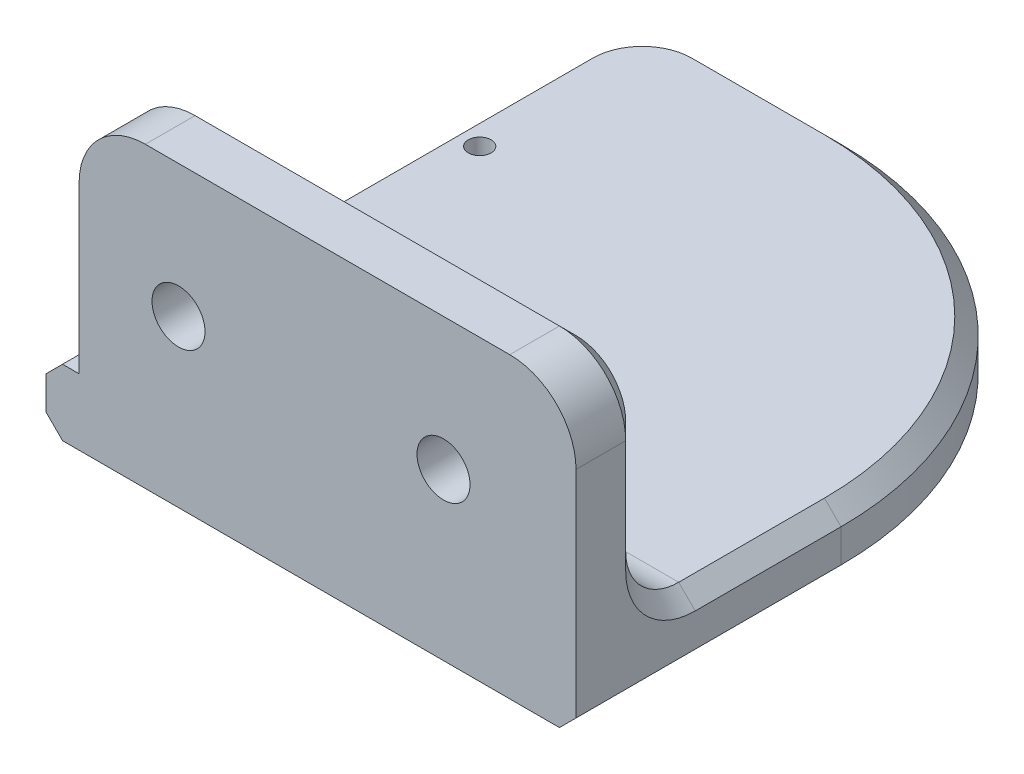
from build123d import *

# Parameters (mm, degrees)
BOSS_EXTRUDE1_DEPTH = 50.8
SKETCH2_R           = 2.54
CUT_EXTRUDE1_DEPTH  = 82.628996839
SKETCH3_R           = 1.0922
CUT_EXTRUDE2_DEPTH  = 82.628996839
FILLET2_R           = 31.75
SKETCH4_W           = 3.175
SKETCH4_H           = 22.225
CUT_EXTRUDE3_DEPTH  = 78.316302453
FILLET3_R           = 6.35
FILLET4_R           = 5.08
CHAMFER1_SIZE       = 1.5875


with BuildPart() as part:
    # Sketch1 → Boss-Extrude1 (new body)
    with BuildSketch(Plane(origin=(0, 0, 0), x_dir=(0, 0, -1), z_dir=(1, 0, 0))):
        Polygon((0, 0), (0, 28.575), (6.35, 28.575), (6.35, 6.35), (57.15, 6.35), (57.15, 0), align=None)
    extrude(amount=BOSS_EXTRUDE1_DEPTH)

    # Sketch2 → Cut-Extrude1 (cut, through all)
    with BuildSketch(Plane.XY):
        with Locations((12.7, 15.875)):
            Circle(SKETCH2_R)
        with Locations((38.1, 15.875)):
            Circle(SKETCH2_R)
    extrude(amount=-CUT_EXTRUDE1_DEPTH, mode=Mode.SUBTRACT)

    # Sketch3 → Cut-Extrude2 (cut, through all)
    with BuildSketch(Plane.XZ):
        with Locations((13.9065, -15.875)):
            Circle(SKETCH3_R)
        with Locations((3.4925, -38.0746)):
            Circle(SKETCH3_R)
    extrude(amount=-CUT_EXTRUDE2_DEPTH, mode=Mode.SUBTRACT)

    # Fillet2
    fillet2_edges = [part.edges().sort_by_distance(p)[0] for p in [
        (50.8, 3.175, -57.15),
    ]]
    fillet(fillet2_edges, radius=FILLET2_R)

    # Sketch4 → Cut-Extrude3 (cut, through all)
    with BuildSketch(Plane(origin=(0, 0, -6.35), x_dir=(-1, 0, 0), z_dir=(0, 0, -1))):
        with Locations((-1.5875, 17.4625)):
            Rectangle(SKETCH4_W, SKETCH4_H)
    extrude(amount=-CUT_EXTRUDE3_DEPTH, mode=Mode.SUBTRACT)

    # Fillet3
    fillet3_edges = [part.edges().sort_by_distance(p)[0] for p in [
        (50.8, 28.575, -3.175),
        (3.175, 28.575, -3.175),
        (0, 3.175, -57.15),
    ]]
    fillet(fillet3_edges, radius=FILLET3_R)

    # Fillet4
    fillet4_edges = [part.edges().sort_by_distance(p)[0] for p in [
        (26.9875, 6.35, -6.35),
    ]]
    fillet(fillet4_edges, radius=FILLET4_R)

    # Chamfer1
    chamfer1_edges = [part.edges().sort_by_distance(p)[0] for p in [
        (50.8, 16.8275, -6.35),
        (50.8, 7.837897552, -7.837897552),
        (50.8, 6.35, -18.415),
        (0, 6.35, -25.4),
        (1.859871939, 6.35, -55.290128061),
        (12.7, 6.35, -57.15),
        (41.500640303, 6.35, -47.850640303),
        (26.9875, 28.575, -6.35),
        (5.034871939, 26.715128061, -6.35),
        (3.175, 16.8275, -6.35),
        (3.175, 7.837897552, -7.837897552),
        (48.940128061, 26.715128061, -6.35),
    ]]
    chamfer(chamfer1_edges, length=CHAMFER1_SIZE)
    chamfer1_2_edges = [part.edges().sort_by_distance(p)[0] for p in [
        (50.8, 0, -12.7),
        (12.7, 0, -57.15),
        (1.859871939, 0, -55.290128061),
        (41.500640303, 0, -47.850640303),
        (0, 0, -25.4),
    ]]
    chamfer(chamfer1_2_edges, length=CHAMFER1_SIZE)


solid = part.part
